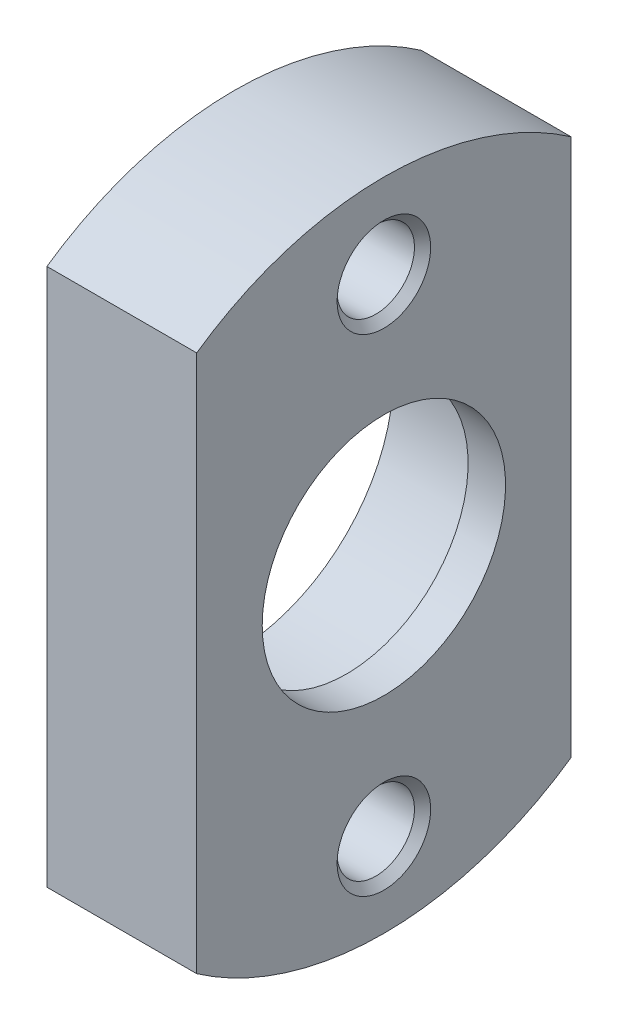
from build123d import *

# Parameters (mm, degrees)
CUT_EXTRUDE_1_DEPTH      = 8
CUT_EXTRUDE_1_DEPTH_BACK = 8
SKETCH_2_R               = 100
SKETCH_2_W               = 20
SKETCH_2_H               = 35


with BuildPart() as part:
    # 草图1 → 旋转1 (revolve)
    with BuildSketch(Plane.XY):
        Polygon((-4, 17.5), (-4, 8.5), (2, 8.5), (2, 6.5), (4, 6.5), (4, 17.5), align=None)
    revolve(axis=Axis((4, 0, 0), (-1, 0, 0)))

    # 草图2 → 切除-拉伸1 (cut, two sides: drawn at the far end of the back side and taken through both)
    with BuildSketch(Plane(origin=(0, 0, 0), x_dir=(0, 0, -1), z_dir=(1, 0, 0)).offset(-CUT_EXTRUDE_1_DEPTH_BACK)):
        Circle(SKETCH_2_R)
        Rectangle(SKETCH_2_W, SKETCH_2_H, mode=Mode.SUBTRACT)
    extrude(amount=CUT_EXTRUDE_1_DEPTH + CUT_EXTRUDE_1_DEPTH_BACK, mode=Mode.SUBTRACT)

    # 草图3 → 切除-旋转1 (revolve, cut)
    with BuildSketch(Plane.XY):
        Polygon((-4, -13), (-4, -10.5), (-3.567, -10.933), (3.567, -10.933), (4, -10.5), (4, -13), align=None)
    revolve(axis=Axis((4, -13, 0), (-1, 0, 0)), mode=Mode.SUBTRACT)

    # 草图4 → 切除-旋转2 (revolve, cut)
    with BuildSketch(Plane.XY):
        Polygon((-4, 13), (-4, 15.5), (-3.567, 15.067), (3.567, 15.067), (4, 15.5), (4, 13), align=None)
    revolve(axis=Axis((4, 13, 0), (-1, 0, 0)), mode=Mode.SUBTRACT)


solid = part.part
